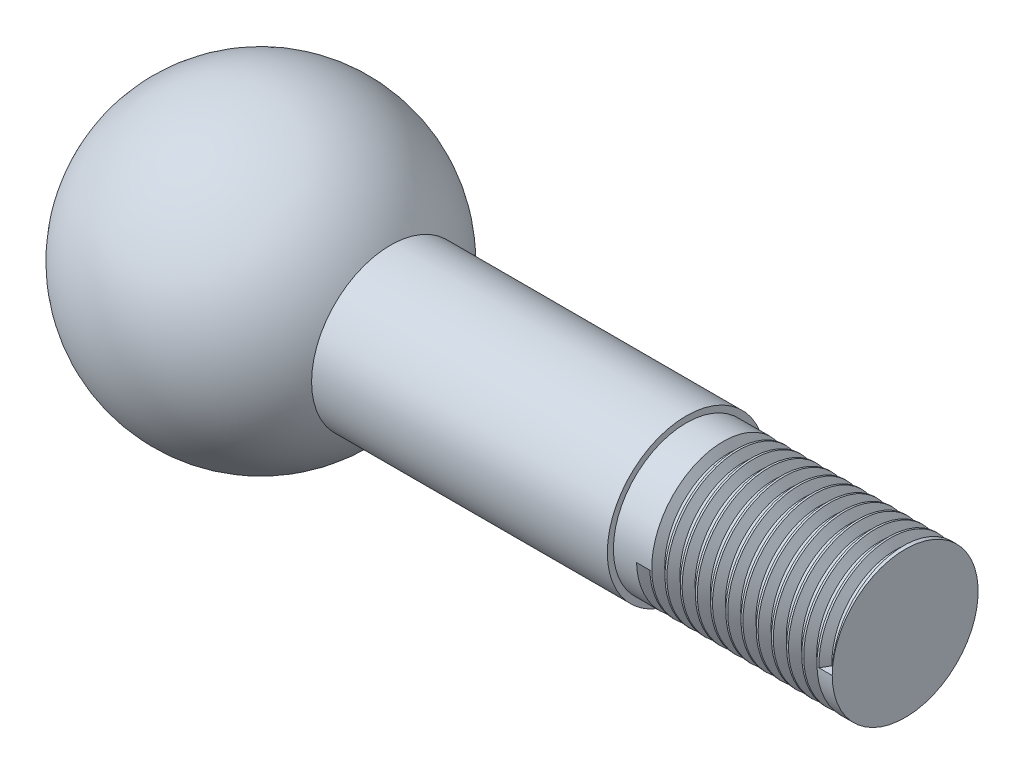
from build123d import *

# Parameters (mm, degrees)
SKETCH2_R           = 6.5
BOSS_EXTRUDE1_DEPTH = 35
SKETCH3_R           = 6
BOSS_EXTRUDE2_DEPTH = 18
THREAD1_PITCH       = 1.25


with BuildPart() as part:
    # Sketch1 → Revolve1 (revolve)
    with BuildSketch(Plane.XY):
        with BuildLine():
            ThreePointArc((0, 0), (12.5, 12.5), (0, 25))
            Line((0, 25), (0, 0))
        make_face()
    revolve(axis=Axis((0, 27.119384278, 0), (0, -1, 0)))

    # Sketch2 → Boss-Extrude1 (add)
    with BuildSketch(Plane(origin=(0, 0, 0), x_dir=(0, 0, -1), z_dir=(1, 0, 0))):
        with Locations(Location((0, 12.5, 0), (0, 0, 180))):
            Circle(SKETCH2_R)
    extrude(amount=BOSS_EXTRUDE1_DEPTH)

    # Sketch3 → Boss-Extrude2 (add)
    with BuildSketch(Plane(origin=(35, 0, 0), x_dir=(0, 0, -1), z_dir=(1, 0, 0))):
        with Locations((0, 12.5)):
            Circle(SKETCH3_R)
    extrude(amount=BOSS_EXTRUDE2_DEPTH)

    # Thread1: the profile of Thread Profile1 profile screwed along a right-hand helix of 12 turns, 8 arcs to a turn; built about Z, then put on its axis
    thread1_z = Axis((0, 0, 0), (0, 0, 1))
    thread1_corners = [(6.0003, 0, -0.000173205), (6.0003, 0, 1.093923202), (5.323417656, 0, 0.703124998), (5.323417656, 0, 0.390624998)]
    with BuildLine(mode=Mode.PRIVATE) as thread1_profile:
        Line(thread1_corners[0], thread1_corners[1])
        Line(thread1_corners[1], thread1_corners[2])
        Line(thread1_corners[2], thread1_corners[3])
        Line(thread1_corners[3], thread1_corners[0])
    thread1_cap = Face(thread1_profile.wire())
    thread1_turn_angles = [0, 22.5, 45, 67.5, 90, 112.5, 135, 157.5, 180, 202.5, 225, 247.5, 270, 292.5, 315, 337.5, 360]
    thread1_turn_weights = [1, 0.9238795325112867, 1, 0.9238795325112867, 1, 0.9238795325112867, 1, 0.9238795325112867, 1, 0.9238795325112867, 1, 0.9238795325112867, 1, 0.9238795325112867, 1, 0.9238795325112867, 1]
    thread1_turn_rails = [Edge.make_bspline([Vector(p[0], p[1], 0).rotate(thread1_z, thread1_turn_angles[k]) / thread1_turn_weights[k] + Vector(0, 0, p[2] + THREAD1_PITCH * thread1_turn_angles[k] / 360) for k in range(17)], [0, 0, 0, 1, 1, 2, 2, 3, 3, 4, 4, 5, 5, 6, 6, 7, 7, 8, 8, 8], 2, thread1_turn_weights) for p in thread1_corners]
    thread1_turn_sides = [Face.make_surface_from_curves(thread1_turn_rails[p[0]], thread1_turn_rails[p[1]]) for p in [(0, 1), (1, 2), (2, 3), (3, 0)]]
    thread1 = Plane(origin=(53, 12.5, 0), x_dir=(0, 0, 1), z_dir=(-1, 0, 0)) * Solid(Shell([*[p.moved(Location((0, 0, THREAD1_PITCH * i))) for i in range(12) for p in thread1_turn_sides], thread1_cap, thread1_cap.rotate(thread1_z, 4320).moved(Location((0, 0, THREAD1_PITCH * 4320 / 360)))]))
    add(thread1, mode=Mode.SUBTRACT)


solid = part.part
